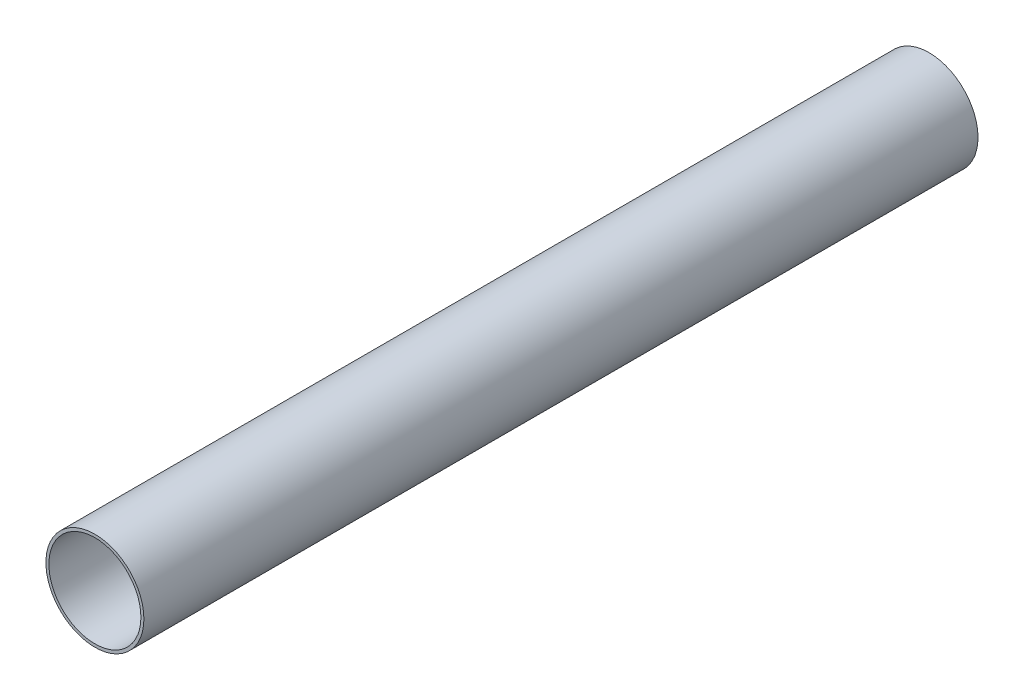
from build123d import *

# Parameters (mm, degrees)
SKETCH1_R           = 20.555
SKETCH1_R_2         = 19.305
BOSS_EXTRUDE3_DEPTH = 350


with BuildPart() as part:
    # Sketch1 → Boss-Extrude3 (new body)
    with BuildSketch(Plane.XY):
        Circle(SKETCH1_R)
        Circle(SKETCH1_R_2, mode=Mode.SUBTRACT)
    extrude(amount=-BOSS_EXTRUDE3_DEPTH)


solid = part.part
